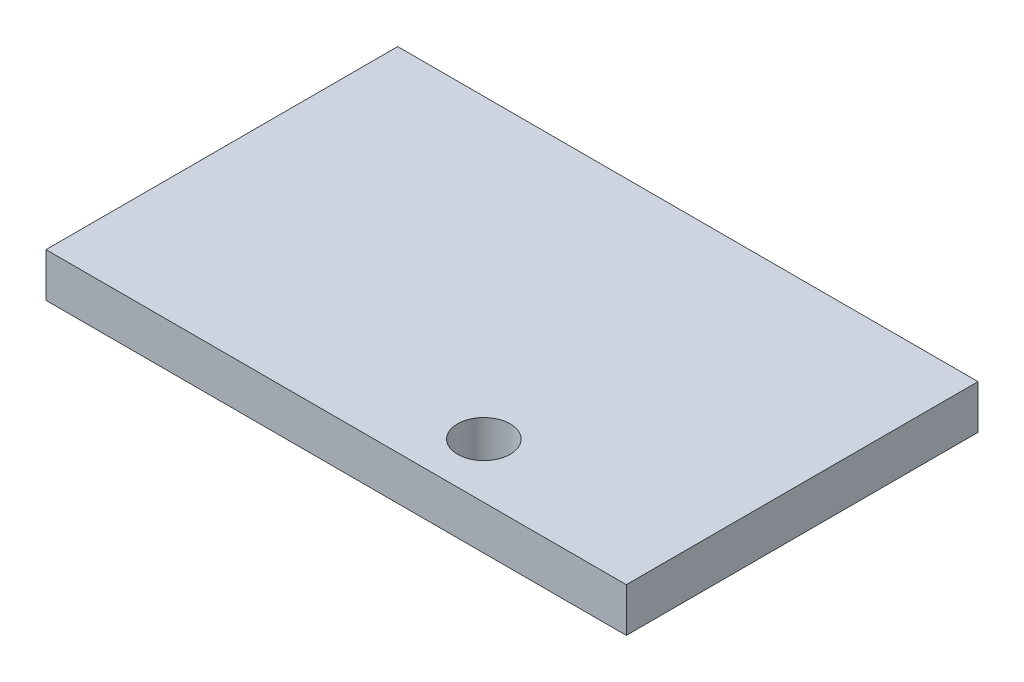
from build123d import *

# Parameters (mm, degrees)
SKETCH1_W           = 33
SKETCH1_H           = 20
BOSS_EXTRUDE1_DEPTH = 2.5
SKETCH2_R           = 1.5
CUT_EXTRUDE1_DEPTH  = 2.5


with BuildPart() as part:
    # Sketch1 → Boss-Extrude1 (new body)
    with BuildSketch(Plane(origin=(0, 0, 0), x_dir=(1, 0, 0), z_dir=(0, 1, 0))):
        with Locations((-0.507092199, -0.716312057)):
            Rectangle(SKETCH1_W, SKETCH1_H)
    extrude(amount=BOSS_EXTRUDE1_DEPTH)

    # Sketch2 → Cut-Extrude1 (cut)
    with BuildSketch(Plane(origin=(0, 2.5, 0), x_dir=(1, 0, 0), z_dir=(0, 1, 0))):
        with Locations((4.772776988, -7.596742092)):
            Circle(SKETCH2_R)
    extrude(amount=-CUT_EXTRUDE1_DEPTH, mode=Mode.SUBTRACT)


solid = part.part
